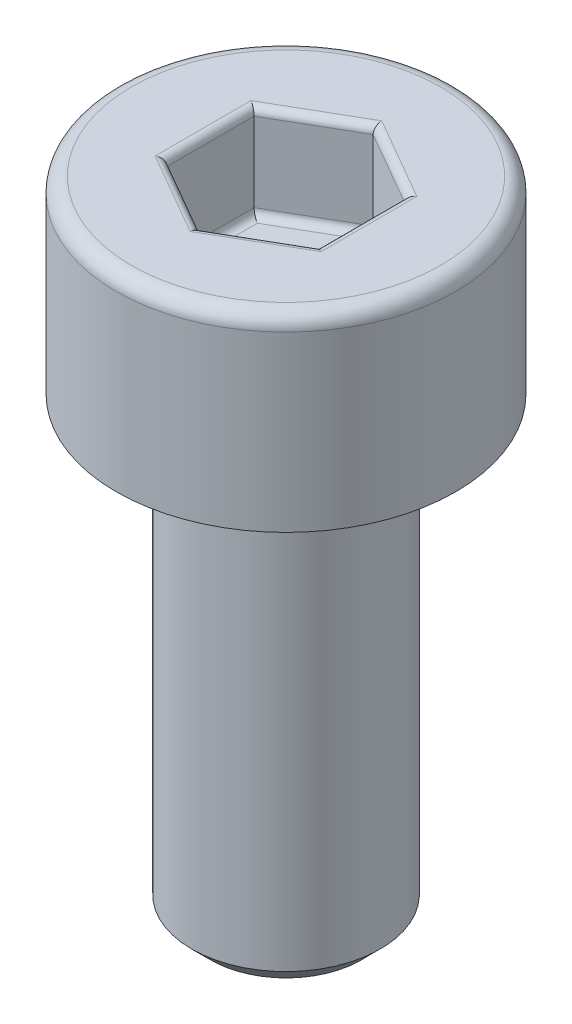
from build123d import *

# Parameters (mm, degrees)
CHAMFER1_SIZE      = 0.25
FILLET1_R          = 0.2
CUT_EXTRUDE1_DEPTH = 1.25
FILLET2_R          = 0.1


with BuildPart() as part:
    # Sketch1 → Revolve1 (revolve)
    with BuildSketch(Plane.XY):
        Polygon((0, -8.5), (-1.25, -8.5), (-1.25, -2.5), (-2.25, -2.5), (-2.25, 0), (0, 0), align=None)
    revolve(axis=Axis((0, 0, 0), (0, -1, 0)))

    # Chamfer1
    chamfer1_edges = [part.edges().sort_by_distance(p)[0] for p in [
        (1.25, -2.5, 0),
        (1.25, -8.5, 0),
    ]]
    chamfer(chamfer1_edges, length=CHAMFER1_SIZE)

    # Fillet1
    fillet1_edges = [part.edges().sort_by_distance(p)[0] for p in [
        (2.25, 0, 0),
    ]]
    fillet(fillet1_edges, radius=FILLET1_R)

    # Sketch2 → Cut-Extrude1 (cut)
    with BuildSketch(Plane(origin=(0, 0, 0), x_dir=(1, 0, 0), z_dir=(0, 1, 0))):
        Polygon((0, 1.154700538), (-1, 0.577350269), (-1, -0.577350269), (0, -1.154700538), (1, -0.577350269), (1, 0.577350269), align=None)
    extrude(amount=-CUT_EXTRUDE1_DEPTH, mode=Mode.SUBTRACT)

    # Fillet2
    fillet2_edges = [part.edges().sort_by_distance(p)[0] for p in [
        (-0.5000000000000006, 0, -0.8660254037844395),
        (-1, 0, 0),
        (-0.5000000000000007, 0, 0.8660254037844379),
        (0.4999999999999988, 0, 0.8660254037844382),
        (1, 0, 0),
        (0.4999999999999987, 0, -0.8660254037844397),
        (1, -1.25, 0),
        (0.5, -1.25, 0.866025404),
        (-0.5, -1.25, 0.866025404),
        (-1, -1.25, 0),
        (-0.5, -1.25, -0.866025404),
        (0.5, -1.25, -0.866025404),
    ]]
    fillet(fillet2_edges, radius=FILLET2_R)


solid = part.part
